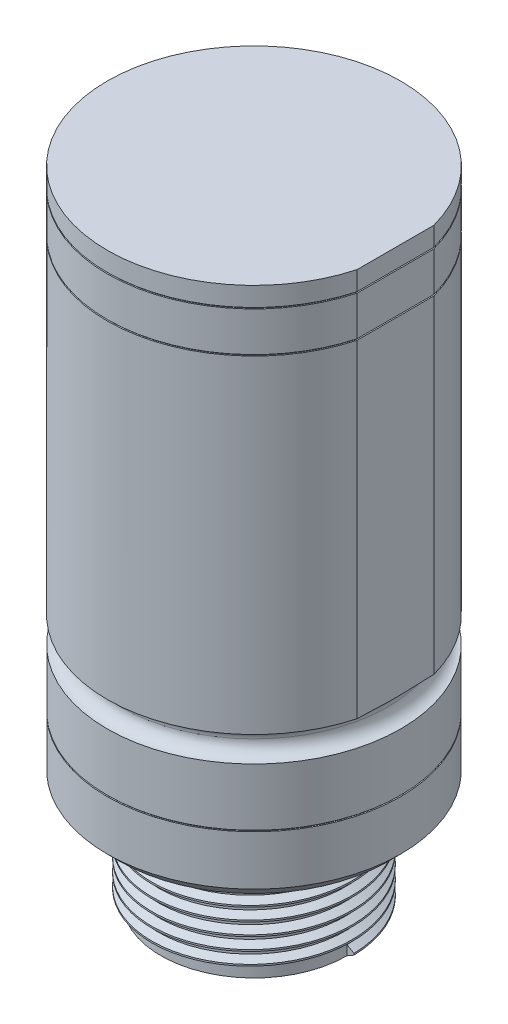
from build123d import *

# Parameters (mm, degrees)
SKETCH1_R           = 11.5
BOSS_EXTRUDE1_DEPTH = 42
SKETCH2_R           = 7.3
SKETCH2_R_2         = 4.5
BOSS_EXTRUDE2_DEPTH = 8
THREAD1_PITCH       = 1
CHAMFER1_SIZE       = 1
SKETCH10_R          = 11.5
SKETCH10_R_2        = 10.5
CUT_EXTRUDE1_DEPTH  = 2
FILLET1_R           = 1
CUT_EXTRUDE2_START  = -0.1
SKETCH11_R          = 11.5
SKETCH11_R_2        = 11.4
CUT_EXTRUDE2_DEPTH  = 0.1
CUT_EXTRUDE3_REACH  = 54.579
CUT_EXTRUDE6_START  = -0.1
CUT_EXTRUDE6_DEPTH  = 0.1
CUT_EXTRUDE7_START  = -0.1
CUT_EXTRUDE7_DEPTH  = 0.1


with BuildPart() as part:
    # Sketch1 → Boss-Extrude1 (new body)
    with BuildSketch(Plane(origin=(0, 0, 0), x_dir=(1, 0, 0), z_dir=(0, 1, 0))):
        with Locations(Location((0, 0, 0), (0, 0, 90))):
            Circle(SKETCH1_R)
    extrude(amount=BOSS_EXTRUDE1_DEPTH)

    # Sketch2 → Boss-Extrude2 (add)
    with BuildSketch(Plane.XZ):
        with Locations(Location((0, 0, 0), (0, 0, 90))):
            Circle(SKETCH2_R)
        with Locations(Location((0, 0, 0), (0, 0, 270))):
            Circle(SKETCH2_R_2, mode=Mode.SUBTRACT)
    extrude(amount=BOSS_EXTRUDE2_DEPTH)

    # Thread1: the profile of Thread Profile1 profile screwed along a right-hand helix of 8 turns, 8 arcs to a turn; built about Z, then put on its axis
    thread1_z = Axis((0, 0, 0), (0, 0, 1))
    thread1_corners = [(7.2997, 0, -0.000173205), (7.841265875, 0, 0.312499999), (7.841265875, 0, 0.437499999), (7.2997, 0, 0.750173202)]
    with BuildLine(mode=Mode.PRIVATE) as thread1_profile:
        Line(thread1_corners[0], thread1_corners[1])
        Line(thread1_corners[1], thread1_corners[2])
        Line(thread1_corners[2], thread1_corners[3])
        Line(thread1_corners[3], thread1_corners[0])
    thread1_cap = Face(thread1_profile.wire())
    thread1_turn_angles = [0, 22.5, 45, 67.5, 90, 112.5, 135, 157.5, 180, 202.5, 225, 247.5, 270, 292.5, 315, 337.5, 360]
    thread1_turn_weights = [1, 0.9238795325112867, 1, 0.9238795325112867, 1, 0.9238795325112867, 1, 0.9238795325112867, 1, 0.9238795325112867, 1, 0.9238795325112867, 1, 0.9238795325112867, 1, 0.9238795325112867, 1]
    thread1_turn_rails = [Edge.make_bspline([Vector(p[0], p[1], 0).rotate(thread1_z, thread1_turn_angles[k]) / thread1_turn_weights[k] + Vector(0, 0, p[2] + THREAD1_PITCH * thread1_turn_angles[k] / 360) for k in range(17)], [0, 0, 0, 1, 1, 2, 2, 3, 3, 4, 4, 5, 5, 6, 6, 7, 7, 8, 8, 8], 2, thread1_turn_weights) for p in thread1_corners]
    thread1_turn_sides = [Face.make_surface_from_curves(thread1_turn_rails[p[0]], thread1_turn_rails[p[1]]) for p in [(0, 1), (1, 2), (2, 3), (3, 0)]]
    thread1 = Plane(origin=(0, -8, 0), x_dir=(1, 0, 0), z_dir=(0, 1, 0)) * Solid(Shell([*[p.moved(Location((0, 0, THREAD1_PITCH * i))) for i in range(8) for p in thread1_turn_sides], thread1_cap, thread1_cap.rotate(thread1_z, 2880).moved(Location((0, 0, THREAD1_PITCH * 2880 / 360)))]))
    add(thread1)

    # Chamfer1
    chamfer1_edges = [part.edges().sort_by_distance(p)[0] for p in [
        (0, 0, 11.5),
    ]]
    chamfer(chamfer1_edges, length=CHAMFER1_SIZE)

    # Sketch10 → Cut-Extrude1 (cut)
    with BuildSketch(Plane(origin=(0, 9.5, 0), x_dir=(1, 0, 0), z_dir=(0, 1, 0))):
        with Locations(Location((0, 0, 0), (0, 0, 90))):
            Circle(SKETCH10_R)
        with Locations(Location((0, 0, 0), (0, 0, 270))):
            Circle(SKETCH10_R_2, mode=Mode.SUBTRACT)
    extrude(amount=CUT_EXTRUDE1_DEPTH, mode=Mode.SUBTRACT)

    # Fillet1
    fillet1_edges = [part.edges().sort_by_distance(p)[0] for p in [
        (0, 9.5, -10.5),
        (0, 11.5, -10.5),
    ]]
    fillet(fillet1_edges, radius=FILLET1_R - 0.0001)  # a hair under: the kernel refuses the full size

    # Sketch11 → Cut-Extrude2 (cut)
    with BuildSketch(Plane(origin=(0, 5, 0), x_dir=(1, 0, 0), z_dir=(0, 1, 0)).offset(CUT_EXTRUDE2_START)):
        with Locations(Location((0, 0, 0), (0, 0, 90))):
            Circle(SKETCH11_R)
        with Locations(Location((0, 0, 0), (0, 0, 270))):
            Circle(SKETCH11_R_2, mode=Mode.SUBTRACT)
    extrude(amount=CUT_EXTRUDE2_DEPTH, mode=Mode.SUBTRACT)

    # Sketch13 → Cut-Extrude3 (cut, up to next)
    with BuildSketch(Plane(origin=(0, 42, 0), x_dir=(1, 0, 0), z_dir=(0, 1, 0)), mode=Mode.PRIVATE) as cut_extrude3_sk1:
        with BuildLine():
            Line((11.1, 3.006659276), (11.1, -3.006659276))
            ThreePointArc((11.1, -3.006659276), (11.5, 0), (11.1, 3.006659276))
        make_face()
    cut_extrude3_tool1 = extrude(cut_extrude3_sk1.sketch, amount=-CUT_EXTRUDE3_REACH, mode=Mode.PRIVATE) & part.part
    add(cut_extrude3_tool1.solids().sort_by_distance((11.260241, 42, 0))[0], mode=Mode.SUBTRACT)

    # Sketch14 → Cut-Extrude6 (cut)
    with BuildSketch(Plane(origin=(0, 40.5, 0), x_dir=(1, 0, 0), z_dir=(0, 1, 0)).offset(CUT_EXTRUDE6_START)):
        with BuildLine():
            Line((11.1, -3.006659276), (11.1, 3.006659276))
            ThreePointArc((11.1, 3.006659276), (-11.5, 0), (11.1, -3.006659276))
        make_face()
        with BuildLine():
            Line((11, -2.993325909), (11, 2.993325909))
            ThreePointArc((11, 2.993325909), (-11.4, 0), (11, -2.993325909))
        make_face(mode=Mode.SUBTRACT)
    extrude(amount=CUT_EXTRUDE6_DEPTH, mode=Mode.SUBTRACT)

    # Sketch15 → Cut-Extrude7 (cut)
    with BuildSketch(Plane(origin=(0, 37.3, 0), x_dir=(1, 0, 0), z_dir=(0, 1, 0)).offset(CUT_EXTRUDE7_START)):
        with BuildLine():
            Line((11.1, -3.006659276), (11.1, 3.006659276))
            ThreePointArc((11.1, 3.006659276), (-11.5, 0), (11.1, -3.006659276))
        make_face()
        with BuildLine():
            Line((11, -2.993325909), (11, 2.993325909))
            ThreePointArc((11, 2.993325909), (-11.4, 0), (11, -2.993325909))
        make_face(mode=Mode.SUBTRACT)
    extrude(amount=CUT_EXTRUDE7_DEPTH, mode=Mode.SUBTRACT)


solid = part.part
